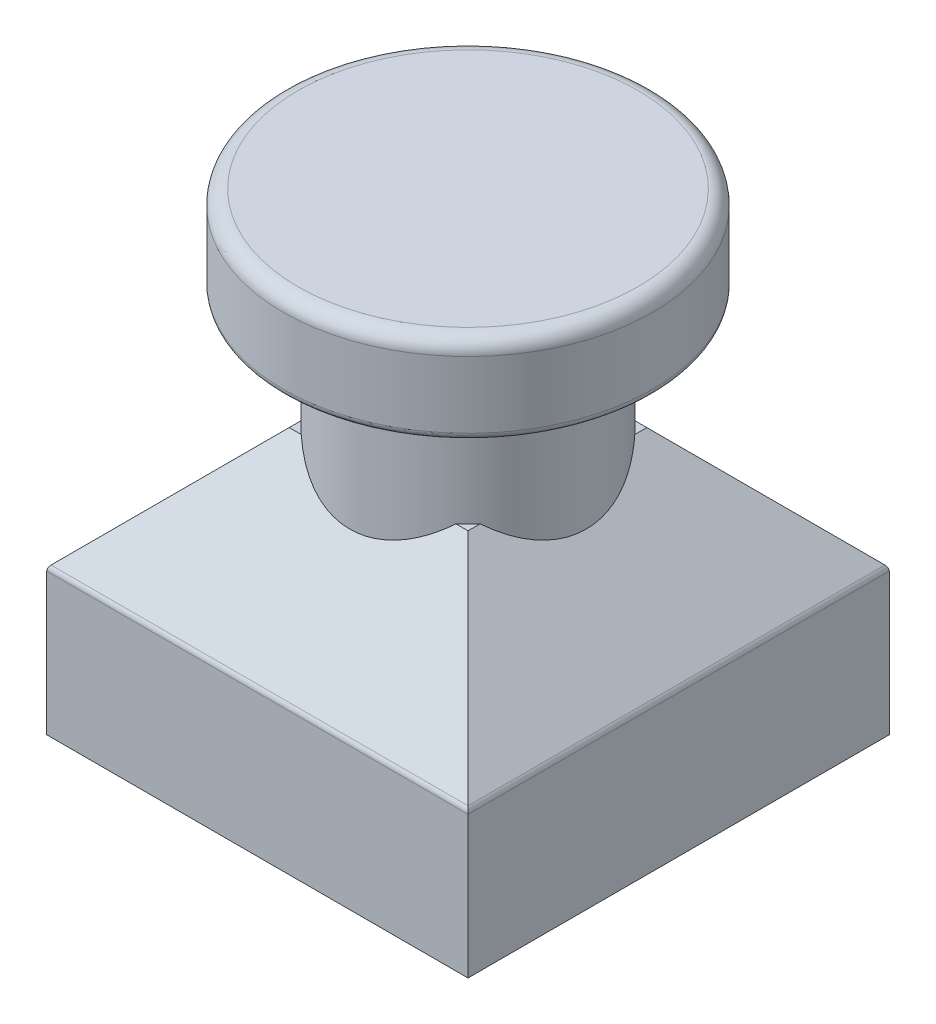
from build123d import *

# Parameters (mm, degrees)
SKIZZE1_W                       = 14.25
SKIZZE1_H                       = 14.25
AUFSATZ_LINEAR_AUSTRAGEN1_DEPTH = 16
FASE1_SIZE                      = 4.1
VERRUNDUNG2_R                   = 0.5
VERRUNDUNG3_R                   = 0.25
VERRUNDUNG4_R                   = 0.25


with BuildPart() as part:
    # Skizze1 → Aufsatz-Linear austragen1 (new body)
    with BuildSketch(Plane(origin=(0, 0, 0), x_dir=(1, 0, 0), z_dir=(0, 1, 0))):
        Rectangle(SKIZZE1_W, SKIZZE1_H)
    extrude(amount=AUFSATZ_LINEAR_AUSTRAGEN1_DEPTH)

    # Skizze6 → Schnitt-Rotation4 (revolve, cut)
    with BuildSketch(Plane(origin=(0, 0, 0), x_dir=(0, 0, -1), z_dir=(1, 0, 0))):
        Polygon((6.25, 16), (13.25, 16), (13.25, 9), (4, 9), (4, 13), (6.25, 13), align=None)
    revolve(axis=Axis((0, 0, 0), (0, 1, 0)), mode=Mode.SUBTRACT)

    # Fase1
    # the kernel refuses this chamfer: 4.1 mm, written as the material it takes off along each edge
    with BuildSketch(Plane(origin=(17.668900251, 9, 7.125), x_dir=(0, 0.027495876610586303, -0.9996219169112966), z_dir=(-1, 0, 0))) as fase1_piece_1_section:
        Polygon((FASE1_SIZE * 0.999621916911, FASE1_SIZE * 0.0274958766106), (-FASE1_SIZE * 0.0274958766106, FASE1_SIZE * 0.999621916911), (0, 0), align=None)
    fase1_piece_1 = extrude(amount=35.337800501, mode=Mode.PRIVATE)
    fase1_piece_1 = fase1_piece_1 - Plane(origin=(0, 7.640449018, 0), x_dir=(0, 0, -1), z_dir=(0, 1, 0)) * Cylinder(4, 88, mode=Mode.PRIVATE)
    add(fase1_piece_1, mode=Mode.SUBTRACT)
    with BuildSketch(Plane(origin=(7.125, 9, -17.668900251), x_dir=(0.027495876610586303, -0.9996219169112966, 0), z_dir=(0, 0, 1))) as fase1_piece_2_section:
        Polygon((FASE1_SIZE * 0.999621916911, -FASE1_SIZE * 0.0274958766106), (-FASE1_SIZE * 0.0274958766106, -FASE1_SIZE * 0.999621916911), (0, 0), align=None)
    fase1_piece_2 = extrude(amount=35.337800501, mode=Mode.PRIVATE)
    fase1_piece_2 = fase1_piece_2 - Plane(origin=(0, 7.640449013, 0), x_dir=(0, 0, -1), z_dir=(0, 1, 0)) * Cylinder(4, 88, mode=Mode.PRIVATE)
    add(fase1_piece_2, mode=Mode.SUBTRACT)
    with BuildSketch(Plane(origin=(-17.668900251, 9, -7.125), x_dir=(0, -0.9996219169112966, -0.027495876610586303), z_dir=(1, 0, 0))) as fase1_piece_3_section:
        Polygon((FASE1_SIZE * 0.999621916911, -FASE1_SIZE * 0.0274958766106), (-FASE1_SIZE * 0.0274958766106, -FASE1_SIZE * 0.999621916911), (0, 0), align=None)
    fase1_piece_3 = extrude(amount=35.337800501, mode=Mode.PRIVATE)
    fase1_piece_3 = fase1_piece_3 - Plane(origin=(0, 7.640449014, 0), x_dir=(0, 0, -1), z_dir=(0, 1, 0)) * Cylinder(4, 88, mode=Mode.PRIVATE)
    add(fase1_piece_3, mode=Mode.SUBTRACT)
    with BuildSketch(Plane(origin=(-7.125, 9, 17.668900251), x_dir=(0.9996219169112966, 0.027495876610586303, 0), z_dir=(0, 0, -1))) as fase1_piece_4_section:
        Polygon((FASE1_SIZE * 0.999621916911, FASE1_SIZE * 0.0274958766106), (-FASE1_SIZE * 0.0274958766106, FASE1_SIZE * 0.999621916911), (0, 0), align=None)
    fase1_piece_4 = extrude(amount=35.337800501, mode=Mode.PRIVATE)
    fase1_piece_4 = fase1_piece_4 - Plane(origin=(0, 7.640449018, 0), x_dir=(0, 0, -1), z_dir=(0, 1, 0)) * Cylinder(4, 88, mode=Mode.PRIVATE)
    add(fase1_piece_4, mode=Mode.SUBTRACT)

    # Verrundung2
    verrundung2_edges = [part.edges().sort_by_distance(p)[0] for p in [
        (0, 16, 6.25),
    ]]
    fillet(verrundung2_edges, radius=VERRUNDUNG2_R)

    # Verrundung3
    verrundung3_edges = [part.edges().sort_by_distance(p)[0] for p in [
        (-7.125, 4.9, 0),
        (0, 4.9, -7.125),
        (7.125, 4.9, 0),
        (0, 4.9, 7.125),
    ]]
    fillet(verrundung3_edges, radius=VERRUNDUNG3_R)

    # Verrundung4
    verrundung4_edges = [part.edges().sort_by_distance(p)[0] for p in [
        (0, 13, 6.25),
    ]]
    fillet(verrundung4_edges, radius=VERRUNDUNG4_R)


solid = part.part
